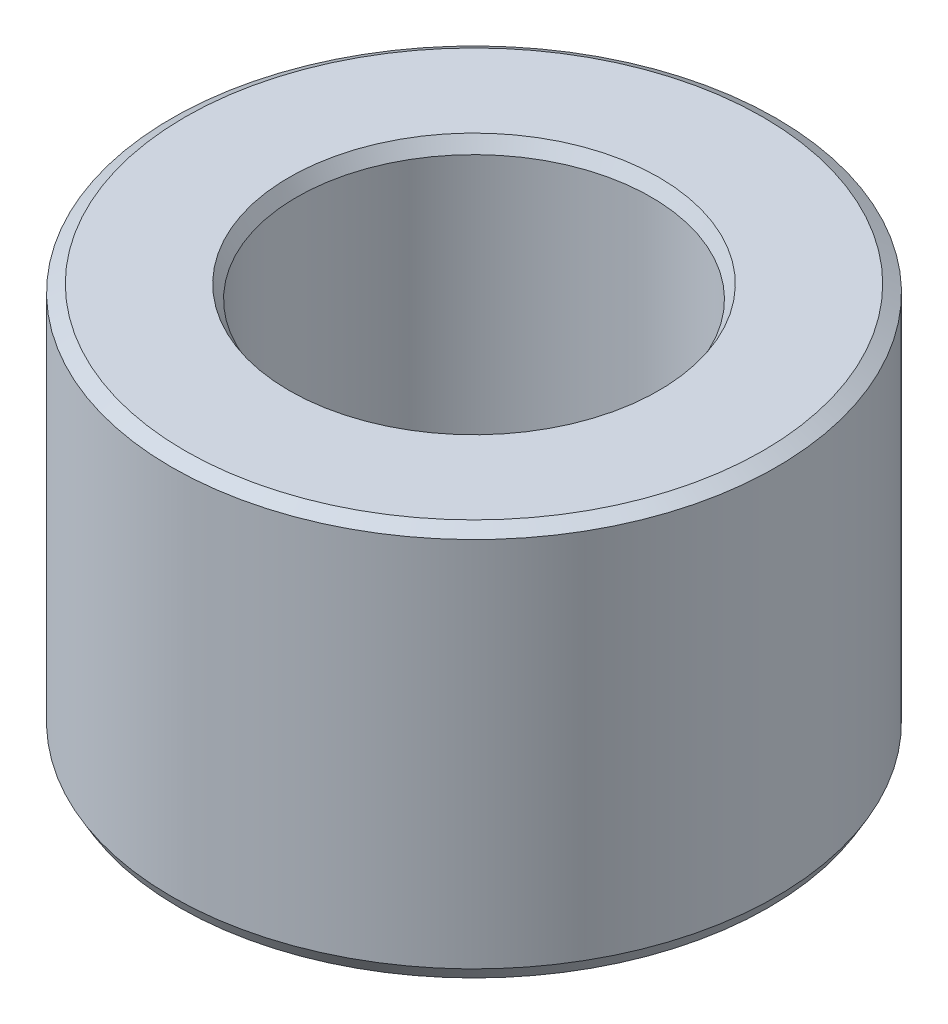
from build123d import *
from OCP.BRepFilletAPI import BRepFilletAPI_MakeChamfer

# Parameters (mm, degrees)
SKETCH1_R           = 35
BOSS_EXTRUDE1_DEPTH = 45.475969111
SKETCH2_R           = 20.508937662
CUT_EXTRUDE1_DEPTH  = 68.216543846
CHAMFER1_SIZE       = 0.886686517
CHAMFER1_SIZE2      = 1.535786098


with BuildPart() as part:
    # Sketch1 → Boss-Extrude1 (new body)
    with BuildSketch(Plane(origin=(0, 0, 0), x_dir=(1, 0, 0), z_dir=(0, 1, 0))):
        Circle(SKETCH1_R)
    extrude(amount=BOSS_EXTRUDE1_DEPTH)

    # Sketch2 → Cut-Extrude1 (cut, through all)
    with BuildSketch(Plane(origin=(0, 0, 0), x_dir=(1, 0, 0), z_dir=(0, 1, 0))):
        Circle(SKETCH2_R)
    extrude(amount=CUT_EXTRUDE1_DEPTH, mode=Mode.SUBTRACT)

    # Chamfer1: one chamfer whose edges measure the first distance from different faces: ONE call of the kernel's chamfer builder (chamfer() names one face for all edges)
    chamfer1_edges_1 = [part.edges().sort_by_distance(p)[0] for p in [
        (-20.508937662, 45.475969111, 0),
    ]]
    chamfer1_side_1 = [part.faces().sort_by_distance(p)[0] for p in [
        (-34.010050506, 45.475969111, 0),
    ]]
    chamfer1_edges_2 = [part.edges().sort_by_distance(p)[0] for p in [
        (-20.508937662, 0, 0),
    ]]
    chamfer1_side_2 = [part.faces().sort_by_distance(p)[0] for p in [
        (-20.508937662, 22.737984555, 0),
    ]]
    chamfer1_edges_3 = [part.edges().sort_by_distance(p)[0] for p in [
        (-35, 0, 0),
    ]]
    chamfer1_side_3 = [part.faces().sort_by_distance(p)[0] for p in [
        (-34.010050506, 0, 0),
    ]]
    chamfer1_edges_4 = [part.edges().sort_by_distance(p)[0] for p in [
        (-35, 45.475969111, 0),
    ]]
    chamfer1_side_4 = [part.faces().sort_by_distance(p)[0] for p in [
        (-35, 22.737984555, 0),
    ]]
    chamfer1 = BRepFilletAPI_MakeChamfer(part.part.solid().wrapped)
    for e in chamfer1_edges_1:
        chamfer1.Add(CHAMFER1_SIZE, CHAMFER1_SIZE2, e.wrapped, chamfer1_side_1[0].wrapped)  # the first distance lies on this face
    for e in chamfer1_edges_2:
        chamfer1.Add(CHAMFER1_SIZE, CHAMFER1_SIZE2, e.wrapped, chamfer1_side_2[0].wrapped)  # the first distance lies on this face
    for e in chamfer1_edges_3:
        chamfer1.Add(CHAMFER1_SIZE, CHAMFER1_SIZE2, e.wrapped, chamfer1_side_3[0].wrapped)  # the first distance lies on this face
    for e in chamfer1_edges_4:
        chamfer1.Add(CHAMFER1_SIZE, CHAMFER1_SIZE2, e.wrapped, chamfer1_side_4[0].wrapped)  # the first distance lies on this face
    add(Compound.cast(chamfer1.Shape()), mode=Mode.REPLACE)


solid = part.part
